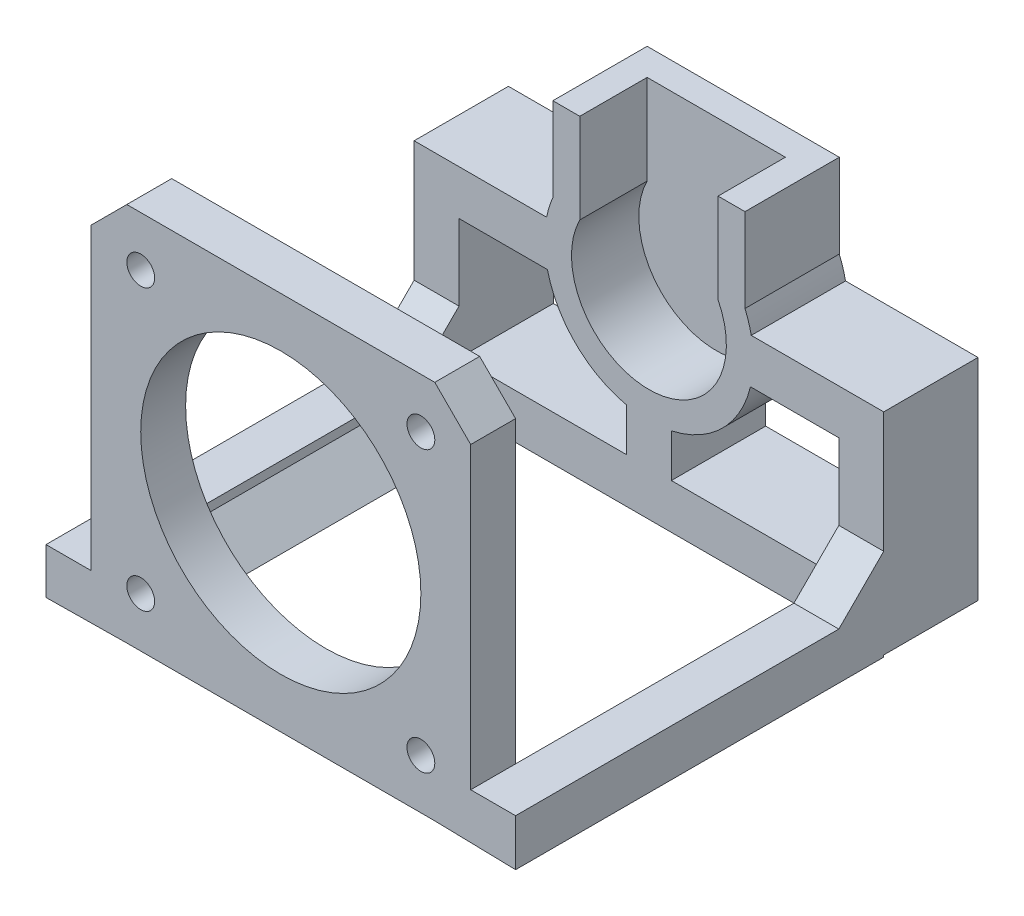
from build123d import *
from build123d.topology import SkipClean

# Parameters (mm, degrees)
SKETCH2_R            = 1.55
SKETCH2_R_2          = 15.6
BOSS_EXTRUDE1_DEPTH  = 5
BOSS_EXTRUDE3_DEPTH  = 41
BOSS_EXTRUDE4_DEPTH  = 7.5
BOSS_EXTRUDE5_DEPTH  = 3
BOSS_EXTRUDE6_START  = -7.5
BOSS_EXTRUDE6_DEPTH  = 10.5
SKETCH12_W           = 10.5
SKETCH12_H           = 5
BOSS_EXTRUDE8_DEPTH  = 23.65
SKETCH13_W           = 10.5
SKETCH13_H           = 5
BOSS_EXTRUDE9_DEPTH  = 23.65
SKETCH14_W           = 5
SKETCH14_H           = 28.65
CUT_EXTRUDE1_DEPTH   = 41
SKETCH15_W           = 5
SKETCH15_H           = 10.5
BOSS_EXTRUDE10_DEPTH = 13.449158782
BOSS_EXTRUDE11_DEPTH = 5
BOSS_EXTRUDE12_DEPTH = 5


# Read off the part's stored shape, not the designer's step: Boss-Extrude6
with BuildPart() as part:
    # Sketch2 → Boss-Extrude1 (new body)
    with BuildSketch(Plane.XY):
        Polygon((-10.909227683, 21.454823411), (23.390772317, 21.454823411), (27.390772317, 17.454823411), (27.390772317, -16.845176589), (23.390772317, -20.845176589), (-10.909227683, -20.845176589), (-14.909227683, -16.845176589), (-14.909227683, 17.454823411), align=None)
        with Locations((-9.359227683, 15.904823411)):
            Circle(SKETCH2_R, mode=Mode.SUBTRACT)
        with Locations(Location((21.840772317, 15.904823411, 0), (0, 0, 180))):
            Circle(SKETCH2_R, mode=Mode.SUBTRACT)
        with Locations((21.840772317, -15.295176589)):
            Circle(SKETCH2_R, mode=Mode.SUBTRACT)
        with Locations(Location((-9.359227683, -15.295176589, 0), (0, 0, 180))):
            Circle(SKETCH2_R, mode=Mode.SUBTRACT)
        with Locations((6.240772317, 0.304823411)):
            Circle(SKETCH2_R_2, mode=Mode.SUBTRACT)
    extrude(amount=BOSS_EXTRUDE1_DEPTH)

    # Sketch4 → Boss-Extrude3 (add)
    with BuildSketch(Plane.XY.offset(5)):
        Polygon((-14.909227683, -12.195176589), (-14.909227683, 0.304823411), (-14.909227683, 12.804823411), (-19.909227683, 12.804823411), (-19.909227683, -12.195176589), (-19.909227683, -20.951034478), (-10.909227683, -20.845176589), (-14.909227683, -16.845176589), align=None)
        Polygon((32.390772317, 12.804823411), (27.390772317, 12.804823411), (27.390772317, 0.304823411), (27.390772317, -12.195176589), (27.390772317, -16.845176589), (23.390772317, -20.845176589), (32.390772317, -21.056892366), (32.390772317, -12.195176589), align=None)
    extrude(amount=-BOSS_EXTRUDE3_DEPTH)

    # Sketch12 → Boss-Extrude8 (add)
    with BuildSketch(Plane.ZY.offset(-3.740772317)):
        with Locations((-41.25, -18.345176589)):
            Rectangle(SKETCH12_W, SKETCH12_H)
    extrude(amount=BOSS_EXTRUDE8_DEPTH)

    # Sketch13 → Boss-Extrude9 (add)
    with BuildSketch(Plane(origin=(8.740772317, 0, 0), x_dir=(0, 0, -1), z_dir=(1, 0, 0))):
        with Locations((41.25, -18.345176589)):
            Rectangle(SKETCH13_W, SKETCH13_H)
    extrude(amount=BOSS_EXTRUDE9_DEPTH)

    # Sketch14 → Cut-Extrude1 (cut)
    with BuildSketch(Plane(origin=(0, 0, -36), x_dir=(-1, 0, 0), z_dir=(0, 0, -1))):
        with Locations((-29.890772317, -1.520176589)):
            Rectangle(SKETCH14_W, SKETCH14_H)
        with Locations((17.409227683, -1.520176589)):
            Rectangle(SKETCH14_W, SKETCH14_H)
    extrude(amount=-CUT_EXTRUDE1_DEPTH, mode=Mode.SUBTRACT)



with BuildPart() as body_2:
    # Sketch5 → Boss-Extrude4 (new body)
    with BuildSketch(Plane(origin=(0, 0, -36), x_dir=(-1, 0, 0), z_dir=(0, 0, -1))):
        with BuildLine():
            ThreePointArc((1.459227683, 4.190775675), (-6.240772317, -8.320176589), (-13.940772317, 4.190775675))
            Line((-13.940772317, 4.190775675), (-13.940772317, 11.190775675))
            Line((-13.940772317, 11.190775675), (-13.940772317, 14.190775675))
            Line((-13.940772317, 14.190775675), (-16.940772317, 14.190775675))
            Line((-16.940772317, 14.190775675), (-16.940772317, 4.849119286))
            ThreePointArc((-16.940772317, 4.849119286), (-6.240772317, -11.320176589), (4.459227683, 4.849119286))
            Line((4.459227683, 4.849119286), (4.459227683, 14.190775675))
            Line((4.459227683, 14.190775675), (1.459227683, 14.190775675))
            Line((1.459227683, 14.190775675), (1.459227683, 11.190775675))
            Line((1.459227683, 11.190775675), (1.459227683, 4.190775675))
        make_face()
    extrude(amount=BOSS_EXTRUDE4_DEPTH)

    # Sketch6 → Boss-Extrude5 (add)
    with SkipClean():  # the faces are left unmerged after this step: merging them gives an invalid solid
        with BuildSketch(Plane(origin=(0, 0, -43.5), x_dir=(-1, 0, 0), z_dir=(0, 0, -1))):
            with BuildLine():
                Line((-16.940772317, 4.849119286), (-16.940772317, 14.190775675))
                Line((-16.940772317, 14.190775675), (4.459227683, 14.190775675))
                Line((4.459227683, 14.190775675), (4.459227683, 4.849119286))
                ThreePointArc((4.459227683, 4.849119286), (-6.240772317, -11.320176589), (-16.940772317, 4.849119286))
            make_face()
        extrude(amount=BOSS_EXTRUDE5_DEPTH)

    # Boss-Extrude6 outline → Boss-Extrude6 (add)
    with SkipClean():  # the faces are left unmerged after this step: merging them gives an invalid solid
        with BuildSketch(Plane(origin=(0, 0, -43.5), x_dir=(-1, 0, 0), z_dir=(0, 0, -1)).offset(BOSS_EXTRUDE6_START)):
            with BuildLine():
                Line((-8.740772317, -20.845176589), (-3.740772317, -20.845176589))
                Line((-3.740772317, -20.845176589), (-3.740772317, -11.048177294))
                ThreePointArc((-3.740772317, -11.048177294), (-6.240772317, -11.320176589), (-8.740772317, -11.048177294))
                Line((-8.740772317, -11.048177294), (-8.740772317, -20.845176589))
            make_face()
            with BuildLine():
                Line((-32.390772317, -2.396017807), (-17.547676478, -2.396017807))
                ThreePointArc((-17.547676478, -2.396017807), (-17.863953086, 0.099168806), (-17.636143917, 2.603982193))
                Line((-17.636143917, 2.603982193), (-32.390772317, 2.603982193))
                Line((-32.390772317, 2.603982193), (-32.390772317, -2.396017807))
            make_face()
            with BuildLine():
                ThreePointArc((5.154599283, 2.603982193), (5.382408452, 0.099168806), (5.066131844, -2.396017807))
                Line((5.066131844, -2.396017807), (19.909227683, -2.396017807))
                Line((19.909227683, -2.396017807), (19.909227683, 2.603982193))
                Line((19.909227683, 2.603982193), (5.154599283, 2.603982193))
            make_face()
        extrude(amount=BOSS_EXTRUDE6_DEPTH)


with BuildPart() as part_1:
    with SkipClean():  # the faces are left unmerged after this step: merging them gives an invalid solid
        add(part.part)

        add(body_2.part)  # Boss-Extrude10 merges body 2
        # Sketch15 → Boss-Extrude10 (add)
        with BuildSketch(Plane(origin=(0, -15.845176589, 0), x_dir=(1, 0, 0), z_dir=(0, 1, 0))):
            with Locations((29.890772317, 41.25)):
                Rectangle(SKETCH15_W, SKETCH15_H)
            with Locations((-17.409227683, 41.25)):
                Rectangle(SKETCH15_W, SKETCH15_H)
        extrude(amount=BOSS_EXTRUDE10_DEPTH)

    # Sketch16 → Boss-Extrude11 (add)
    with SkipClean():  # the faces are left unmerged after this step: merging them gives an invalid solid
        with BuildSketch(Plane(origin=(32.390772317, 0, 0), x_dir=(0, 0, -1), z_dir=(1, 0, 0))):
            Polygon((36, -10.845176589), (31, -15.845176589), (36, -15.845176589), align=None)
        extrude(amount=-BOSS_EXTRUDE11_DEPTH)

    # Sketch18 → Boss-Extrude12 (add)
    with SkipClean():  # the faces are left unmerged after this step: merging them gives an invalid solid
        with BuildSketch(Plane.ZY.offset(19.909227683)):
            Polygon((-36, -10.845176589), (-31, -15.845176589), (-36, -15.845176589), align=None)
        extrude(amount=-BOSS_EXTRUDE12_DEPTH)


solid = part_1.part
